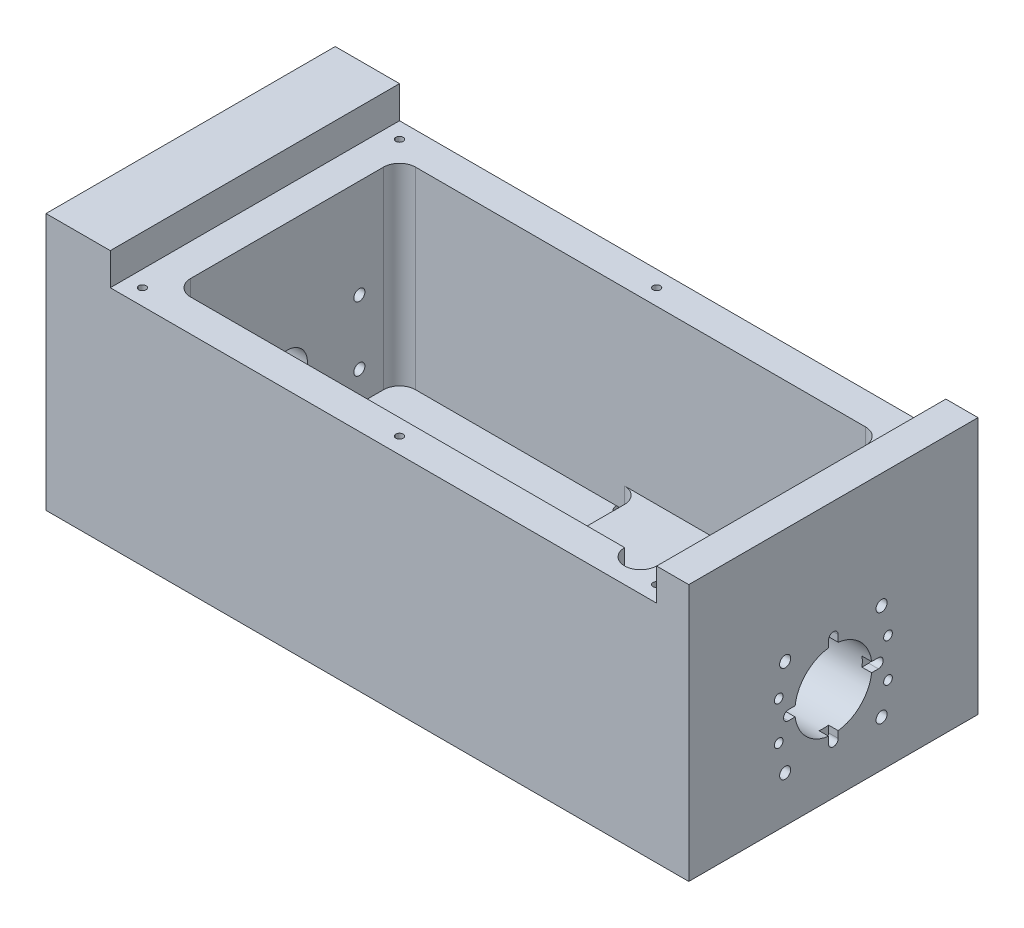
from build123d import *

# Parameters (mm, degrees)
SKETCH5_W                                      = 200
SKETCH5_H                                      = 90
BOSS_EXTRUDE1_DEPTH                            = 80
SKETCH6_W                                      = 150
SKETCH6_H                                      = 70
CAVITYBED_DEPTH                                = 70
DIODEHOLDER_SM05_TAPPED_HOLE1_REACH            = 235.452
DIODEHOLDER_SM05_TAPPED_HOLE1_BORE_R           = 6.35
FILLET1_R                                      = 5
SKETCH33_W                                     = 170
SKETCH33_H                                     = 90
LIDGROOVE_DEPTH                                = 10
SKETCH35_W                                     = 85
SKETCH35_H                                     = 90
FILTERPLATFORM_DEPTH                           = 16.6
FILLET3_R                                      = 5
FILTERMOUNTGROOVE_DEPTH                        = 5
FILTERMOUNTCUT_DEPTH                           = 11.6
SKETCH42_R                                     = 12
OUTPUTHOLE_DEPTH                               = 20
SKETCH54_R                                     = 3
SKETCH54_R_2                                   = 1.5
THERMISTER_AD590_DIODE_DEPTH                   = 20
SKETCH61_W                                     = 57
SKETCH61_H                                     = 57
TEC_GROOVES_DEPTH                              = 1
LENSPLATEMOUNTINGHOLES_8_32_TAPPED_HOLE1_REACH = 235.452
LENSPLATEMOUNTINGHOLES_8_32_TAPPED_H_2_R       = 1.7272
PIEZOPLATE_MOUNTING_HOLES_6_32_TAPPED_HO_REACH = 235.452
PIEZOPLATE_MOUNTING_HOLES_6_32_TAPPE_2_R       = 1.35255
LENSPLATEOUTPUTMOUNTING_4_40_TAPPED_HOLE_D     = 3.4544
LENSPLATEOUTPUTMOUNTING_4_40_TAPPED_HOLE_DEPTH = 10
LENSPLATEOUTPUTMOUNTING_4_40_TAPPED_HOLE_TIP   = 1.037806461
COVERLIDTHREADS_D                              = 2.2606
COVERLIDTHREADS_DEPTH                          = 15
COVERLIDTHREADS_TIP                            = 0.679152758
BOTTOMMOUNTING_1_4_20_TAPPED_HOLE2_OUTLI_R     = 2.5527
BOTTOMMOUNTING_1_4_20_TAPPED_HOLE2_DEPTH       = 10
SKETCH67_R                                     = 4.949158555
CUT_EXTRUDE1_DEPTH                             = 53.4
CUT_EXTRUDE2_DEPTH                             = 3


# Read off the part's stored shape, not the designer's step: BottomMounting_1/4-20 Tapped Hole2
with BuildPart() as part:
    # Sketch5 → Boss-Extrude1 (new body)
    with BuildSketch(Plane(origin=(0, 0, 0), x_dir=(1, 0, 0), z_dir=(0, 1, 0))):
        with Locations((100, 45)):
            Rectangle(SKETCH5_W, SKETCH5_H)
    extrude(amount=BOSS_EXTRUDE1_DEPTH)

    # Sketch6 → CavityBed (cut)
    with BuildSketch(Plane(origin=(0, 80, 0), x_dir=(1, 0, 0), z_dir=(0, 1, 0))):
        with Locations((105, 45)):
            Rectangle(SKETCH6_W, SKETCH6_H)
    extrude(amount=-CAVITYBED_DEPTH, mode=Mode.SUBTRACT)

    # DiodeHolder_SM05_Tapped Hole1 bore → DiodeHolder_SM05_Tapped Hole1 (cut, up to next)
    with BuildSketch(Plane.ZY, mode=Mode.PRIVATE) as diodeholder_sm05_tapped_hole1_sk1:
        with Locations((-45, 29.3)):
            Circle(DIODEHOLDER_SM05_TAPPED_HOLE1_BORE_R)
    diodeholder_sm05_tapped_hole1_tool1 = extrude(diodeholder_sm05_tapped_hole1_sk1.sketch, amount=-DIODEHOLDER_SM05_TAPPED_HOLE1_REACH, mode=Mode.PRIVATE) & part.part
    add(diodeholder_sm05_tapped_hole1_tool1.solids().sort_by_distance((0, 29.3, -45))[0], mode=Mode.SUBTRACT)

    # Fillet1
    fillet1_edges = [part.edges().sort_by_distance(p)[0] for p in [
        (180, 45, -80),
        (30, 45, -80),
        (30, 45, -10),
    ]]
    fillet(fillet1_edges, radius=FILLET1_R)

    # Sketch33 → LidGroove (cut)
    with BuildSketch(Plane(origin=(0, 80, 0), x_dir=(1, 0, 0), z_dir=(0, 1, 0))):
        with Locations((105, 45)):
            Rectangle(SKETCH33_W, SKETCH33_H)
    extrude(amount=-LIDGROOVE_DEPTH, mode=Mode.SUBTRACT)

    # Sketch35 → FilterPlatform (add)
    with BuildSketch(Plane.XZ):
        with Locations((147.5, -45)):
            Rectangle(SKETCH35_W, SKETCH35_H)
    extrude(amount=-FILTERPLATFORM_DEPTH)

    # Fillet3
    fillet3_edges = [part.edges().sort_by_distance(p)[0] for p in [
        (105, 13.3, -10),
        (105, 13.3, -80),
    ]]
    fillet(fillet3_edges, radius=FILLET3_R)

    # Sketch36 → FilterMountGroove (cut)
    with BuildSketch(Plane.XZ):
        with BuildLine():
            Line((129.5, -37.5), (129.5, -52.5))
            ThreePointArc((129.5, -52.5), (125, -57), (120.5, -52.5))
            Line((120.5, -52.5), (120.5, -37.5))
            ThreePointArc((120.5, -37.5), (125, -33), (129.5, -37.5))
        make_face()
    extrude(amount=-FILTERMOUNTGROOVE_DEPTH, mode=Mode.SUBTRACT)

    # Sketch60 → FilterMountCut (cut)
    with BuildSketch(Plane.XZ.offset(-5)):
        with BuildLine():
            Line((122.75, -54.5), (122.75, -35.5))
            ThreePointArc((122.75, -35.5), (125, -33.25), (127.25, -35.5))
            Line((127.25, -35.5), (127.25, -54.5))
            ThreePointArc((127.25, -54.5), (125, -56.75), (122.75, -54.5))
        make_face()
    extrude(amount=-FILTERMOUNTCUT_DEPTH, mode=Mode.SUBTRACT)

    # Sketch42 → OutputHole (cut)
    with BuildSketch(Plane(origin=(200, 0, 0), x_dir=(0, 0, -1), z_dir=(1, 0, 0))):
        with Locations((45, 29.3)):
            Circle(SKETCH42_R)
    extrude(amount=-OUTPUTHOLE_DEPTH, mode=Mode.SUBTRACT)

    # Sketch54 → thermister_AD590_diode (cut)
    with BuildSketch(Plane.ZY):
        with Locations((-33, 29.3)):
            Circle(SKETCH54_R)
        with Locations((-55.5, 29.3)):
            Circle(SKETCH54_R_2)
    extrude(amount=-THERMISTER_AD590_DIODE_DEPTH, mode=Mode.SUBTRACT)

    # Sketch61 → TEC_grooves (cut)
    with BuildSketch(Plane.XZ):
        with Locations((50, -45)):
            Rectangle(SKETCH61_W, SKETCH61_H)
        with Locations((150, -45)):
            Rectangle(SKETCH61_W, SKETCH61_H)
    extrude(amount=-TEC_GROOVES_DEPTH, mode=Mode.SUBTRACT)

    # LensPlateMountingHoles_8-32 Tapped H 2 → LensPlateMountingHoles#8-32 Tapped Hole1 (cut, up to next)
    with BuildSketch(Plane.ZY, mode=Mode.PRIVATE) as lensplatemountingholes_8_32_tapped_hole1_sk1:
        with Locations((-67.5, 39.3)):
            Circle(LENSPLATEMOUNTINGHOLES_8_32_TAPPED_H_2_R)
    lensplatemountingholes_8_32_tapped_hole1_tool1 = extrude(lensplatemountingholes_8_32_tapped_hole1_sk1.sketch, amount=-LENSPLATEMOUNTINGHOLES_8_32_TAPPED_HOLE1_REACH, mode=Mode.PRIVATE) & part.part
    # LensPlateMountingHoles_8-32 Tapped H 2 → LensPlateMountingHoles#8-32 Tapped Hole1 (cut, up to next)
    with BuildSketch(Plane.ZY, mode=Mode.PRIVATE) as lensplatemountingholes_8_32_tapped_hole1_sk2:
        with Locations((-22.5, 39.3)):
            Circle(LENSPLATEMOUNTINGHOLES_8_32_TAPPED_H_2_R)
    lensplatemountingholes_8_32_tapped_hole1_tool2 = extrude(lensplatemountingholes_8_32_tapped_hole1_sk2.sketch, amount=-LENSPLATEMOUNTINGHOLES_8_32_TAPPED_HOLE1_REACH, mode=Mode.PRIVATE) & part.part
    # LensPlateMountingHoles_8-32 Tapped H 2 → LensPlateMountingHoles#8-32 Tapped Hole1 (cut, up to next)
    with BuildSketch(Plane.ZY, mode=Mode.PRIVATE) as lensplatemountingholes_8_32_tapped_hole1_sk3:
        with Locations((-22.5, 19.3)):
            Circle(LENSPLATEMOUNTINGHOLES_8_32_TAPPED_H_2_R)
    lensplatemountingholes_8_32_tapped_hole1_tool3 = extrude(lensplatemountingholes_8_32_tapped_hole1_sk3.sketch, amount=-LENSPLATEMOUNTINGHOLES_8_32_TAPPED_HOLE1_REACH, mode=Mode.PRIVATE) & part.part
    # LensPlateMountingHoles_8-32 Tapped H 2 → LensPlateMountingHoles#8-32 Tapped Hole1 (cut, up to next)
    with BuildSketch(Plane.ZY, mode=Mode.PRIVATE) as lensplatemountingholes_8_32_tapped_hole1_sk4:
        with Locations((-67.5, 19.3)):
            Circle(LENSPLATEMOUNTINGHOLES_8_32_TAPPED_H_2_R)
    lensplatemountingholes_8_32_tapped_hole1_tool4 = extrude(lensplatemountingholes_8_32_tapped_hole1_sk4.sketch, amount=-LENSPLATEMOUNTINGHOLES_8_32_TAPPED_HOLE1_REACH, mode=Mode.PRIVATE) & part.part
    add(lensplatemountingholes_8_32_tapped_hole1_tool1.solids().sort_by_distance((0, 39.3, -67.5))[0], mode=Mode.SUBTRACT)
    add(lensplatemountingholes_8_32_tapped_hole1_tool2.solids().sort_by_distance((0, 39.3, -22.5))[0], mode=Mode.SUBTRACT)
    add(lensplatemountingholes_8_32_tapped_hole1_tool3.solids().sort_by_distance((0, 19.3, -22.5))[0], mode=Mode.SUBTRACT)
    add(lensplatemountingholes_8_32_tapped_hole1_tool4.solids().sort_by_distance((0, 19.3, -67.5))[0], mode=Mode.SUBTRACT)

    # PiezoPlate_Mounting_holes_6-32 Tappe 2 → PiezoPlate_Mounting_holes#6-32 Tapped Hole2 (cut, up to next)
    with BuildSketch(Plane(origin=(200, 0, 0), x_dir=(0, 0, -1), z_dir=(1, 0, 0)), mode=Mode.PRIVATE) as piezoplate_mounting_holes_6_32_tapped_ho_sk1:
        with Locations((28, 35.3)):
            Circle(PIEZOPLATE_MOUNTING_HOLES_6_32_TAPPE_2_R)
    piezoplate_mounting_holes_6_32_tapped_ho_tool1 = extrude(piezoplate_mounting_holes_6_32_tapped_ho_sk1.sketch, amount=-PIEZOPLATE_MOUNTING_HOLES_6_32_TAPPED_HO_REACH, mode=Mode.PRIVATE) & part.part
    # PiezoPlate_Mounting_holes_6-32 Tappe 2 → PiezoPlate_Mounting_holes#6-32 Tapped Hole2 (cut, up to next)
    with BuildSketch(Plane(origin=(200, 0, 0), x_dir=(0, 0, -1), z_dir=(1, 0, 0)), mode=Mode.PRIVATE) as piezoplate_mounting_holes_6_32_tapped_ho_sk2:
        with Locations((62, 35.3)):
            Circle(PIEZOPLATE_MOUNTING_HOLES_6_32_TAPPE_2_R)
    piezoplate_mounting_holes_6_32_tapped_ho_tool2 = extrude(piezoplate_mounting_holes_6_32_tapped_ho_sk2.sketch, amount=-PIEZOPLATE_MOUNTING_HOLES_6_32_TAPPED_HO_REACH, mode=Mode.PRIVATE) & part.part
    # PiezoPlate_Mounting_holes_6-32 Tappe 2 → PiezoPlate_Mounting_holes#6-32 Tapped Hole2 (cut, up to next)
    with BuildSketch(Plane(origin=(200, 0, 0), x_dir=(0, 0, -1), z_dir=(1, 0, 0)), mode=Mode.PRIVATE) as piezoplate_mounting_holes_6_32_tapped_ho_sk3:
        with Locations((62, 23.3)):
            Circle(PIEZOPLATE_MOUNTING_HOLES_6_32_TAPPE_2_R)
    piezoplate_mounting_holes_6_32_tapped_ho_tool3 = extrude(piezoplate_mounting_holes_6_32_tapped_ho_sk3.sketch, amount=-PIEZOPLATE_MOUNTING_HOLES_6_32_TAPPED_HO_REACH, mode=Mode.PRIVATE) & part.part
    # PiezoPlate_Mounting_holes_6-32 Tappe 2 → PiezoPlate_Mounting_holes#6-32 Tapped Hole2 (cut, up to next)
    with BuildSketch(Plane(origin=(200, 0, 0), x_dir=(0, 0, -1), z_dir=(1, 0, 0)), mode=Mode.PRIVATE) as piezoplate_mounting_holes_6_32_tapped_ho_sk4:
        with Locations((28, 23.3)):
            Circle(PIEZOPLATE_MOUNTING_HOLES_6_32_TAPPE_2_R)
    piezoplate_mounting_holes_6_32_tapped_ho_tool4 = extrude(piezoplate_mounting_holes_6_32_tapped_ho_sk4.sketch, amount=-PIEZOPLATE_MOUNTING_HOLES_6_32_TAPPED_HO_REACH, mode=Mode.PRIVATE) & part.part
    add(piezoplate_mounting_holes_6_32_tapped_ho_tool1.solids().sort_by_distance((200, 35.3, -28))[0], mode=Mode.SUBTRACT)
    add(piezoplate_mounting_holes_6_32_tapped_ho_tool2.solids().sort_by_distance((200, 35.3, -62))[0], mode=Mode.SUBTRACT)
    add(piezoplate_mounting_holes_6_32_tapped_ho_tool3.solids().sort_by_distance((200, 23.3, -62))[0], mode=Mode.SUBTRACT)
    add(piezoplate_mounting_holes_6_32_tapped_ho_tool4.solids().sort_by_distance((200, 23.3, -28))[0], mode=Mode.SUBTRACT)

    # LensPlateOutputMounting#4-40 Tapped Hole3
    with Locations(Plane(origin=(200, 0, 0), x_dir=(0, 0, -1), z_dir=(1, 0, 0))):
        with Locations((30, 44.3), (60, 44.3), (60, 14.3), (30, 14.3)):
            Hole(LENSPLATEOUTPUTMOUNTING_4_40_TAPPED_HOLE_D / 2, depth=LENSPLATEOUTPUTMOUNTING_4_40_TAPPED_HOLE_DEPTH)
            with Locations((0, 0, -(LENSPLATEOUTPUTMOUNTING_4_40_TAPPED_HOLE_DEPTH + LENSPLATEOUTPUTMOUNTING_4_40_TAPPED_HOLE_TIP / 2))):  # 118° drill point
                Cone(0, LENSPLATEOUTPUTMOUNTING_4_40_TAPPED_HOLE_D / 2, LENSPLATEOUTPUTMOUNTING_4_40_TAPPED_HOLE_TIP, mode=Mode.SUBTRACT)

    # CoverLidThreads
    with Locations(Plane(origin=(0, 70, 0), x_dir=(1, 0, 0), z_dir=(0, 1, 0))):
        with Locations((25, 85), (185, 85), (185, 5), (25, 5), (105, 5), (105, 85)):
            Hole(COVERLIDTHREADS_D / 2, depth=COVERLIDTHREADS_DEPTH)
            with Locations((0, 0, -(COVERLIDTHREADS_DEPTH + COVERLIDTHREADS_TIP / 2))):  # 118° drill point
                Cone(0, COVERLIDTHREADS_D / 2, COVERLIDTHREADS_TIP, mode=Mode.SUBTRACT)

    # BottomMounting_1/4-20 Tapped Hole2 outli → BottomMounting_1/4-20 Tapped Hole2 (cut)
    with BuildSketch(Plane(origin=(0, 0, 0), x_dir=(1, 0, 0), z_dir=(0, 1, 0))):
        with Locations((100, 80)):
            Circle(BOTTOMMOUNTING_1_4_20_TAPPED_HOLE2_OUTLI_R)
        with Locations((100, 10)):
            Circle(BOTTOMMOUNTING_1_4_20_TAPPED_HOLE2_OUTLI_R)
    extrude(amount=BOTTOMMOUNTING_1_4_20_TAPPED_HOLE2_DEPTH, mode=Mode.SUBTRACT)

    # BottomMounting_1_4-20 Tapped Hole2 2 out → BottomMounting_1_4-20 Tapped Hole2 2 (revolve, cut)
    with BuildSketch(Plane(origin=(10, 0, -80), x_dir=(1, 0, 0), z_dir=(0, 0, 1))):
        Polygon((2.5527, 10), (0, 11.533816902), (0, 0), (2.5527, 0), align=None)
    revolve(axis=Axis((10, 0, -80), (0, 1, 0)), mode=Mode.SUBTRACT)

    # BottomMounting_1_4-20 Tapped Hole2 3 out → BottomMounting_1_4-20 Tapped Hole2 3 (revolve, cut)
    with BuildSketch(Plane(origin=(10, 0, -10), x_dir=(1, 0, 0), z_dir=(0, 0, 1))):
        Polygon((2.5527, 10), (0, 11.533816902), (0, 0), (2.5527, 0), align=None)
    revolve(axis=Axis((10, 0, -10), (0, 1, 0)), mode=Mode.SUBTRACT)

    # BottomMounting_1_4-20 Tapped Hole2 4 out → BottomMounting_1_4-20 Tapped Hole2 4 (revolve, cut)
    with BuildSketch(Plane(origin=(190, 0, -10), x_dir=(1, 0, 0), z_dir=(0, 0, 1))):
        Polygon((2.5527, 10), (0, 11.533816902), (0, 0), (2.5527, 0), align=None)
    revolve(axis=Axis((190, 0, -10), (0, 1, 0)), mode=Mode.SUBTRACT)

    # BottomMounting_1_4-20 Tapped Hole2 5 out → BottomMounting_1_4-20 Tapped Hole2 5 (revolve, cut)
    with BuildSketch(Plane(origin=(190, 0, -80), x_dir=(1, 0, 0), z_dir=(0, 0, 1))):
        Polygon((2.5527, 10), (0, 11.533816902), (0, 0), (2.5527, 0), align=None)
    revolve(axis=Axis((190, 0, -80), (0, 1, 0)), mode=Mode.SUBTRACT)

    # Sketch67 → Cut-Extrude1 (cut)
    with BuildSketch(Plane(origin=(0, 70, 0), x_dir=(1, 0, 0), z_dir=(0, 1, 0))):
        with Locations((175, 10)):
            Circle(SKETCH67_R)
    extrude(amount=-CUT_EXTRUDE1_DEPTH, mode=Mode.SUBTRACT)

    # Sketch69 → Cut-Extrude2 (cut)
    with BuildSketch(Plane(origin=(200, 0, 0), x_dir=(0, 0, -1), z_dir=(1, 0, 0))):
        with BuildLine():
            Line((43.5, 15.3), (43.5, 43.3))
            ThreePointArc((43.5, 43.3), (45, 44.8), (46.5, 43.3))
            Line((46.5, 43.3), (46.5, 15.3))
            ThreePointArc((46.5, 15.3), (45, 13.8), (43.5, 15.3))
        make_face()
        with BuildLine():
            Line((31, 30.8), (59, 30.8))
            ThreePointArc((59, 30.8), (60.5, 29.3), (59, 27.8))
            Line((59, 27.8), (31, 27.8))
            ThreePointArc((31, 27.8), (29.5, 29.3), (31, 30.8))
        make_face()
    extrude(amount=-CUT_EXTRUDE2_DEPTH, mode=Mode.SUBTRACT)


solid = part.part
